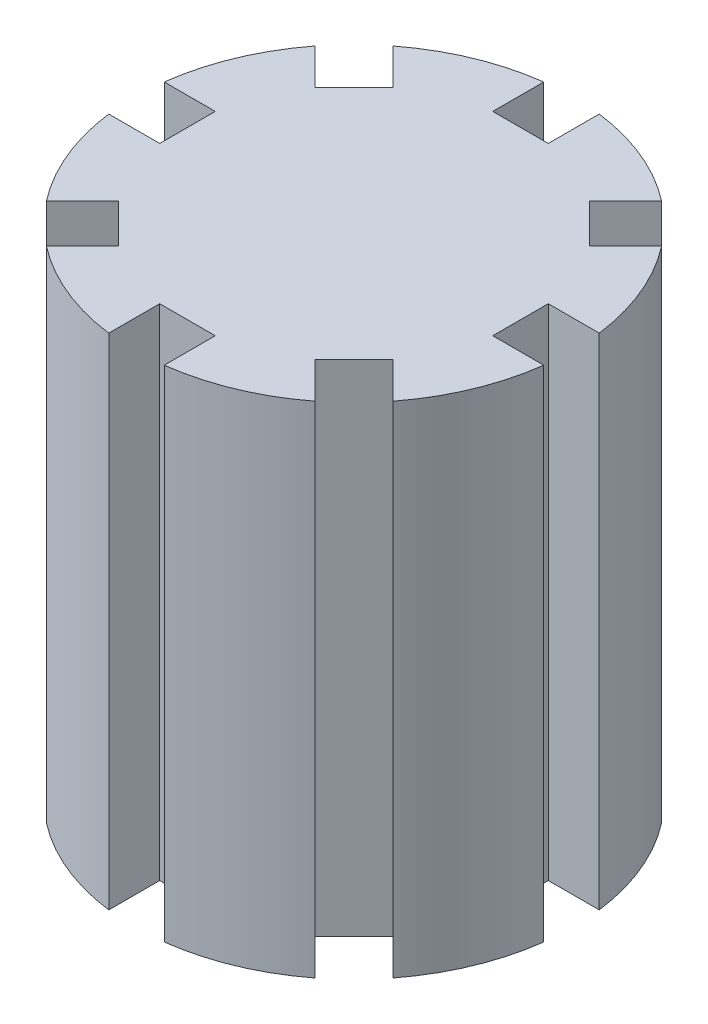
from build123d import *

# Parameters (mm, degrees)
SKETCH1_R           = 3.95
BOSS_EXTRUDE1_DEPTH = 5
BOSS_EXTRUDE2_START = -4
SKETCH1_3_R         = 3.95
SKETCH1_3_R_2       = 2.375
BOSS_EXTRUDE2_DEPTH = 4
SKETCH2_W           = 1
SKETCH2_H           = 1
CUT_EXTRUDE1_DEPTH  = 11.592686156
CIRPATTERN1_COUNT   = 8


with BuildPart() as part:
    # Sketch1 → Boss-Extrude1 (new body)
    with BuildSketch(Plane(origin=(0, 0, 0), x_dir=(1, 0, 0), z_dir=(0, 1, 0))):
        Circle(SKETCH1_R)
    extrude(amount=BOSS_EXTRUDE1_DEPTH)

    # Sketch1<3> → Boss-Extrude2 (add)
    with BuildSketch(Plane(origin=(0, 0, 0), x_dir=(1, 0, 0), z_dir=(0, 1, 0)).offset(BOSS_EXTRUDE2_START)):
        Circle(SKETCH1_3_R)
        Circle(SKETCH1_3_R_2, mode=Mode.SUBTRACT)
    extrude(amount=BOSS_EXTRUDE2_DEPTH)

    # Sketch2 → Cut-Extrude1 (cut, through all)
    with BuildSketch(Plane.XZ.offset(4)):
        with Locations((0, 3.5)):
            Rectangle(SKETCH2_W, SKETCH2_H)
    cut_extrude1 = extrude(amount=-CUT_EXTRUDE1_DEPTH, mode=Mode.SUBTRACT)

    # CirPattern1: Cut-Extrude1 ×8 about axis
    cirpattern1_axis = Axis((0, -4, 0), (0, 1, 0))
    for i in range(1, CIRPATTERN1_COUNT):
        add(cut_extrude1.rotate(cirpattern1_axis, i * 360 / CIRPATTERN1_COUNT), mode=Mode.SUBTRACT)


solid = part.part
